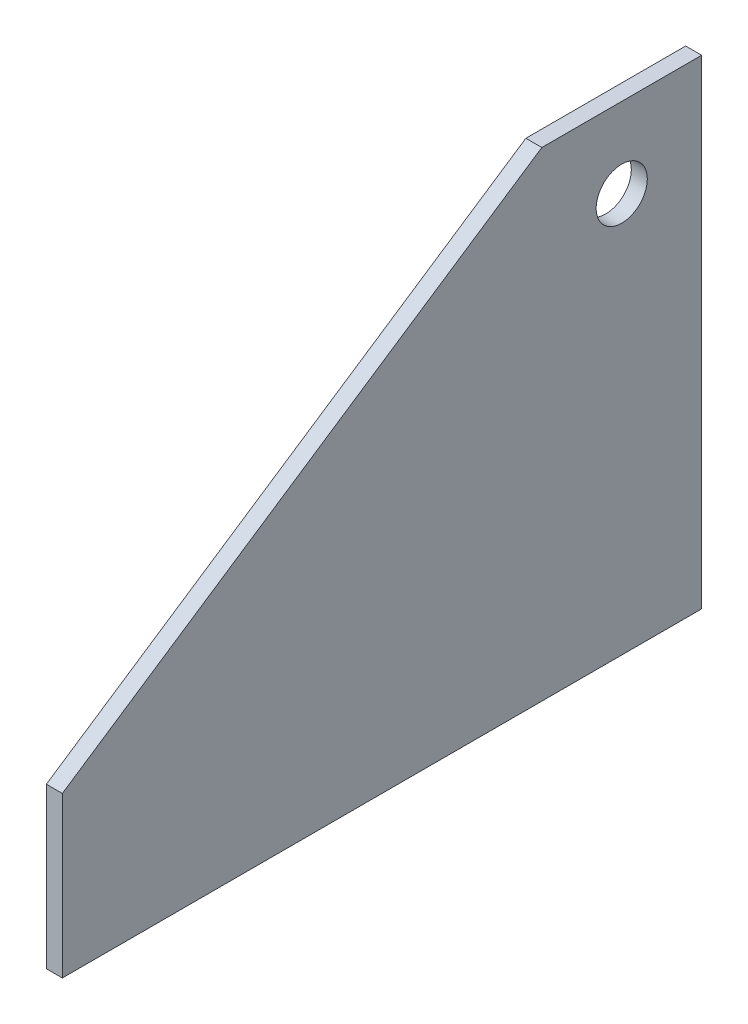
from build123d import *

# Parameters (mm, degrees)
CROQUIS1_R              = 8
SALIENTE_EXTRUIR1_DEPTH = 5


with BuildPart() as part:
    # Croquis1 → Saliente-Extruir1 (new body)
    with BuildSketch(Plane(origin=(0, 0, 0), x_dir=(0, 0, -1), z_dir=(1, 0, 0))):
        Polygon((50, 75), (-100, -25), (-100, -75), (100, -75), (100, 75), align=None)
        with Locations((75, 50)):
            Circle(CROQUIS1_R, mode=Mode.SUBTRACT)
    extrude(amount=SALIENTE_EXTRUIR1_DEPTH)


solid = part.part
